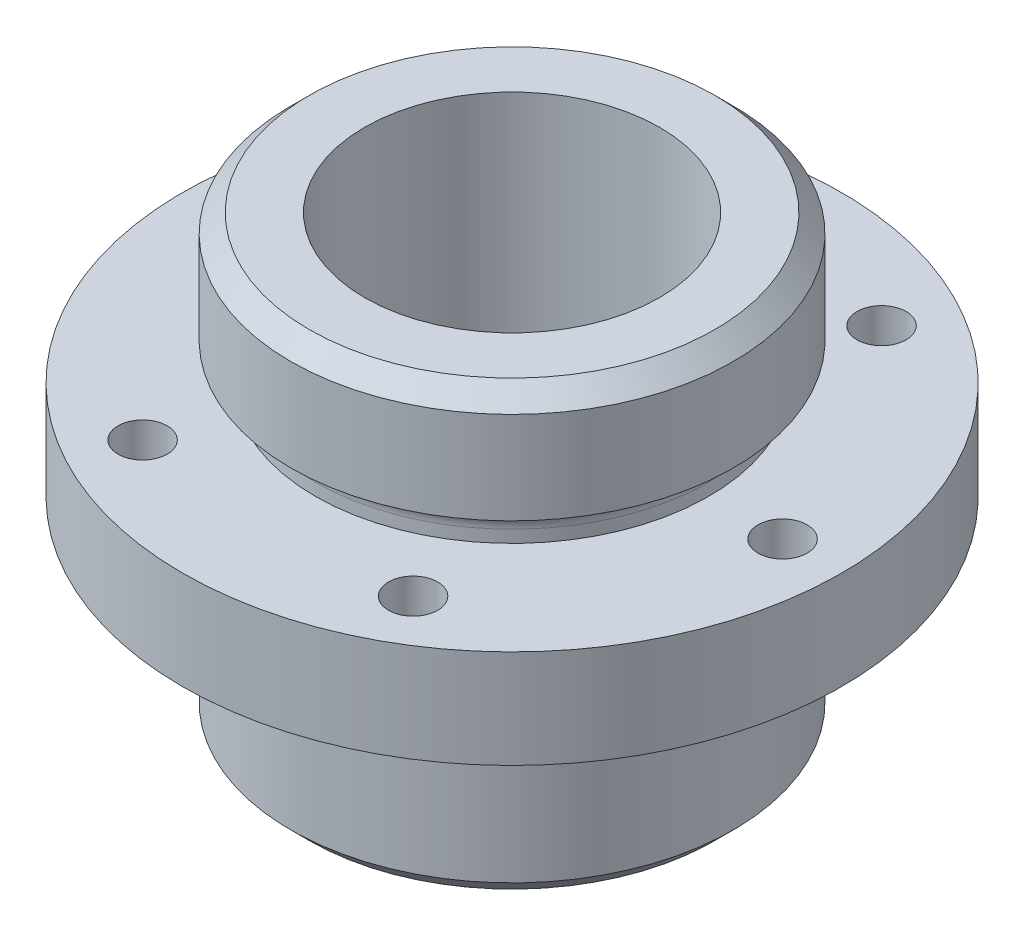
from build123d import *

# Parameters (mm, degrees)
SKETCH1_R           = 53.614398493
SKETCH1_R_2         = 4
BOSS_EXTRUDE1_DEPTH = 16
SKETCH3_R           = 32
BOSS_EXTRUDE2_DEPTH = 6
SKETCH4_R           = 36
BOSS_EXTRUDE3_DEPTH = 18
BOSS_EXTRUDE4_START = 8
SKETCH5_R           = 32
BOSS_EXTRUDE4_DEPTH = 8
BOSS_EXTRUDE5_START = 24
SKETCH6_R           = 36
BOSS_EXTRUDE5_DEPTH = 24
FILLET2_R           = 4
CHAMFER2_SIZE       = 3
SKETCH7_R           = 24
CUT_EXTRUDE1_DEPTH  = 72


with BuildPart() as part:
    # Sketch1 → Boss-Extrude1 (new body)
    with BuildSketch(Plane(origin=(0, 0, 0), x_dir=(1, 0, 0), z_dir=(0, 1, 0))):
        with Locations(Location((0, 0, 0), (0, 0, 270))):
            Circle(SKETCH1_R)
        with Locations(Location((-44, 0, 0), (0, 0, 270))):
            Circle(SKETCH1_R_2, mode=Mode.SUBTRACT)
        with Locations(Location((-22, 38.105117767, 0), (0, 0, 270))):
            Circle(SKETCH1_R_2, mode=Mode.SUBTRACT)
        with Locations(Location((22, 38.105117767, 0), (0, 0, 270))):
            Circle(SKETCH1_R_2, mode=Mode.SUBTRACT)
        with Locations(Location((44, 0, 0), (0, 0, 270))):
            Circle(SKETCH1_R_2, mode=Mode.SUBTRACT)
        with Locations(Location((22, -38.105117767, 0), (0, 0, 270))):
            Circle(SKETCH1_R_2, mode=Mode.SUBTRACT)
        with Locations(Location((-22, -38.105117767, 0), (0, 0, 270))):
            Circle(SKETCH1_R_2, mode=Mode.SUBTRACT)
    extrude(amount=BOSS_EXTRUDE1_DEPTH)

    # Sketch3 → Boss-Extrude2 (add)
    with BuildSketch(Plane(origin=(0, 16, 0), x_dir=(1, 0, 0), z_dir=(0, 1, 0))):
        with Locations(Location((0, 0, 0), (0, 0, 270))):
            Circle(SKETCH3_R)
    extrude(amount=BOSS_EXTRUDE2_DEPTH)

    # Sketch4 → Boss-Extrude3 (add)
    with BuildSketch(Plane(origin=(0, 22, 0), x_dir=(1, 0, 0), z_dir=(0, 1, 0))):
        with Locations(Location((0, 0, 0), (0, 0, 270))):
            Circle(SKETCH4_R)
    extrude(amount=BOSS_EXTRUDE3_DEPTH)

    # Sketch5 → Boss-Extrude4 (add)
    with BuildSketch(Plane.XZ.offset(BOSS_EXTRUDE4_START)):
        with Locations(Location((0, 0, 0), (0, 0, 90))):
            Circle(SKETCH5_R)
    extrude(amount=-BOSS_EXTRUDE4_DEPTH)

    # Sketch6 → Boss-Extrude5 (add)
    with BuildSketch(Plane.XZ.offset(8).offset(BOSS_EXTRUDE5_START)):
        with Locations(Location((0, 0, 0), (0, 0, 90))):
            Circle(SKETCH6_R)
    extrude(amount=-BOSS_EXTRUDE5_DEPTH)

    # Fillet2
    fillet2_edges = [part.edges().sort_by_distance(p)[0] for p in [
        (0, 22, -32),
        (0, -8, -32),
    ]]
    fillet(fillet2_edges, radius=FILLET2_R - 0.0001)  # a hair under: the kernel refuses the full size

    # Chamfer2
    chamfer2_edges = [part.edges().sort_by_distance(p)[0] for p in [
        (0, 40, -36),
        (0, -32, -36),
    ]]
    chamfer(chamfer2_edges, length=CHAMFER2_SIZE)

    # Sketch7 → Cut-Extrude1 (cut)
    with BuildSketch(Plane(origin=(0, 40, 0), x_dir=(1, 0, 0), z_dir=(0, 1, 0))):
        with Locations(Location((0, 0, 0), (0, 0, 270))):
            Circle(SKETCH7_R)
    extrude(amount=-CUT_EXTRUDE1_DEPTH, mode=Mode.SUBTRACT)


solid = part.part
